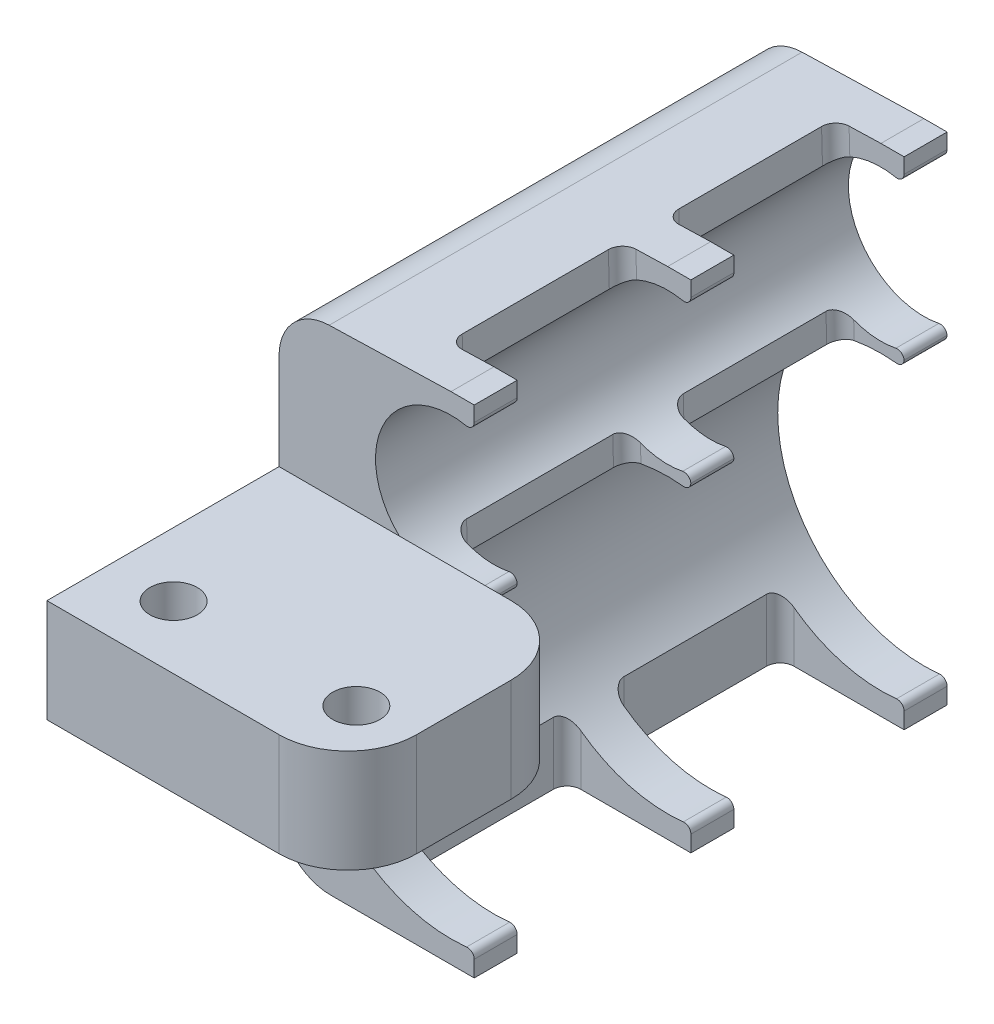
from build123d import *

# Parameters (mm, degrees)
BOSS_EXTRUDE1_DEPTH     = 69.85
CUT_EXTRUDE1_DEPTH      = 2.54
CUT_EXTRUDE1_DEPTH_BACK = 105.044993435
SKETCH2_W               = 16.044844987
SKETCH2_H               = 25.145576203
SKETCH2_H_2             = 25.654423797
CUT_EXTRUDE2_DEPTH      = 13.97
FILLET1_R               = 1.016
FILLET2_R               = 2.032
SKETCH4_W               = 34.29
SKETCH4_H               = 15.24
BOSS_EXTRUDE2_DEPTH     = 44.45
FILLET3_R               = 10.16
SKETCH5_R               = 3.5
CUT_EXTRUDE3_DEPTH      = 91.143248047
FILLET4_R               = 7.62


with BuildPart() as part:
    # Sketch1 → Boss-Extrude1 (new body)
    with BuildSketch(Plane.XY):
        with BuildLine():
            Line((3.429, -21.315957849), (3.429, -24.871957849))
            Line((3.429, -24.871957849), (0, -24.871957849))
            Line((0, -24.871957849), (-25.4, -24.871957849))
            Line((-25.4, -24.871957849), (-25.4, 47.724146141))
            Line((-25.4, 47.724146141), (0, 48.429639909))
            Line((0, 48.429639909), (3.429, 48.429639909))
            Line((3.429, 48.429639909), (3.429, 44.873639909))
            ThreePointArc((3.429, 44.873639909), (-11.15, 34.264), (3.429, 23.654360091))
            Line((3.429, 23.654360091), (3.429, 21.315957849))
            ThreePointArc((3.429, 21.315957849), (-21.59, 0), (3.429, -21.315957849))
        make_face()
    extrude(amount=-BOSS_EXTRUDE1_DEPTH)

    # Sketch2 → Cut-Extrude1 (cut, two sides: drawn at the far end of the back side and taken through both)
    with BuildSketch(Plane(origin=(-1.344113023, 48.392306706, 0), x_dir=(0.9996144881434057, 0.027764637469221053, 0), z_dir=(-0.027764637469221053, 0.9996144881434057, 0)).offset(-CUT_EXTRUDE1_DEPTH_BACK)):
        with Locations((2.634731969, 50.927211899)):
            Rectangle(SKETCH2_W, SKETCH2_H)
        with Locations((2.634731969, 19.177211899)):
            Rectangle(SKETCH2_W, SKETCH2_H_2)
    extrude(amount=CUT_EXTRUDE1_DEPTH + CUT_EXTRUDE1_DEPTH_BACK, mode=Mode.SUBTRACT)

    # Sketch3 → Cut-Extrude2 (cut)
    with BuildSketch(Plane.XZ.offset(24.871957849)):
        Polygon((-4.69894113, -6.35), (-14.85894113, -6.35), (-14.85894113, -32.004423797), (-7.683449997, -32.004423797), (-4.37926474, -32.004423797), (-4.37926474, -6.35), align=None)
        Polygon((-4.69894113, -38.354423797), (-14.85894113, -38.354423797), (-14.85894113, -63.5), (-7.683449997, -63.5), (-2.422701427, -63.5), (-2.422701427, -38.354423797), align=None)
    extrude(amount=-CUT_EXTRUDE2_DEPTH, mode=Mode.SUBTRACT)

    # Fillet1
    # the kernel refuses this fillet: 1.016 mm, written as the material it takes off along each edge
    with BuildSketch(Plane(origin=(3.429, -21.315957849, -60.597776235), x_dir=(-0.9911390490997786, -0.13282840565777682, 0), z_dir=(0, 0, -1)), Plane(origin=(3.429, -21.315957849, -29.102200032), x_dir=(-0.9911390490997786, -0.13282840565777682, 0), z_dir=(0, 0, -1))) as fillet1_piece_1:
        with BuildLine():
            CenterArc((1.161196376, -1.015649261), FILLET1_R, 91.505550469, 96.127515329)
            Line((0.154199102, -1.150602921), (0, 0))
            ThreePointArc((0, 0), (0.567251103, -0.007453204), (1.134502207, 0))
        make_face()
    extrude(amount=12.15444753, mode=Mode.SUBTRACT)
    with BuildSketch(Plane(origin=(3.429, 44.873639909, -60.213343849), x_dir=(-0.967377188342964, 0.25334043394938266, 0), z_dir=(0, 0, -1)), Plane(origin=(3.429, 44.873639909, -28.717767646), x_dir=(-0.967377188342964, 0.25334043394938266, 0), z_dir=(0, 0, -1)), Plane(origin=(3.429, 44.873639909, 3.286656151), x_dir=(-0.967377188342964, 0.25334043394938266, 0), z_dir=(0, 0, -1))) as fillet1_piece_2:
        with BuildLine():
            CenterArc((1.315912382, 1.014380594), FILLET1_R, 165.324729703, 101.43988218)
            Line((0.333057158, 1.271774475), (0, 0))
            ThreePointArc((0, 0), (0.6292856, 0.017772027), (1.2585712, 0))
        make_face()
    extrude(amount=12.923312302, mode=Mode.SUBTRACT)
    with BuildSketch(Plane(origin=(3.429, 23.654360091, -60.213343849), x_dir=(-0.9673771883429638, -0.2533404339493828, 0), z_dir=(0, 0, -1)), Plane(origin=(3.429, 23.654360091, -28.717767646), x_dir=(-0.9673771883429638, -0.2533404339493828, 0), z_dir=(0, 0, -1)), Plane(origin=(3.429, 23.654360091, 3.286656151), x_dir=(-0.9673771883429638, -0.2533404339493828, 0), z_dir=(0, 0, -1))) as fillet1_piece_3:
        with BuildLine():
            CenterArc((1.315912382, -1.014380594), FILLET1_R, 93.235388117, 101.43988218)
            Line((0.333057158, -1.271774475), (0, 0))
            ThreePointArc((0, 0), (0.6292856, -0.017772027), (1.2585712, 0))
        make_face()
    extrude(amount=12.923312302, mode=Mode.SUBTRACT)
    with BuildSketch(Plane(origin=(3.429, 21.315957849, -60.597776235), x_dir=(-0.9911390490997777, 0.13282840565778328, 0), z_dir=(0, 0, -1)), Plane(origin=(3.429, 21.315957849, -29.102200032), x_dir=(-0.9911390490997777, 0.13282840565778328, 0), z_dir=(0, 0, -1)), Plane(origin=(3.429, 21.315957849, 2.902223765), x_dir=(-0.9911390490997777, 0.13282840565778328, 0), z_dir=(0, 0, -1))) as fillet1_piece_4:
        with BuildLine():
            CenterArc((1.161196376, 1.015649261), FILLET1_R, 172.366934203, 96.127515328)
            Line((0.154199102, 1.150602921), (0, 0))
            ThreePointArc((0, 0), (0.567251103, 0.007453204), (1.134502207, 0))
        make_face()
    extrude(amount=12.15444753, mode=Mode.SUBTRACT)
    with BuildSketch(Plane(origin=(3.429, -21.315957849, 2.902223765), x_dir=(0, -1, 0), z_dir=(0, 0, -1))) as fillet1_piece_5:
        with BuildLine():
            CenterArc((1.160889506, 1.016), FILLET1_R, 173.872484672, 96.127515328)
            ThreePointArc((0.150694119, 1.124449438), (0.082734222, 0.561234722), (0, 0))
            Line((0, 0), (1.160889506, 0))
        make_face()
    extrude(amount=12.15444753, mode=Mode.SUBTRACT)

    # Fillet2
    fillet2_edges = [part.edges().sort_by_distance(p)[0] for p in [
        (-14.85894113, -20.267644911, -6.35),
        (-14.85894113, -20.267644911, -32.004423797),
        (-14.85894113, -20.267644911, -38.354423797),
        (-14.85894113, -20.267644911, -63.5),
        (-6.023991911, 22.834048029, -63.5),
        (-6.660489458, 45.749966547, -63.5),
        (-6.660489458, 45.749966547, -38.354423797),
        (-6.023991911, 22.834048029, -38.354423797),
        (-6.023991911, 22.834048029, -32.004423797),
        (-6.660489458, 45.749966547, -32.004423797),
        (-6.660489458, 45.749966547, -6.35),
        (-6.023991911, 22.834048029, -6.35),
    ]]
    fillet(fillet2_edges, radius=FILLET2_R)

    # Sketch4 → Boss-Extrude2 (add)
    with BuildSketch(Plane.ZY.offset(25.4)):
        with Locations((17.145, 18.514146141)):
            Rectangle(SKETCH4_W, SKETCH4_H)
    extrude(amount=-BOSS_EXTRUDE2_DEPTH)

    # Fillet3
    fillet3_edges = [part.edges().sort_by_distance(p)[0] for p in [
        (19.05, 18.514146141, 0),
        (19.05, 18.514146141, 34.29),
    ]]
    fillet(fillet3_edges, radius=FILLET3_R)

    # Sketch5 → Cut-Extrude3 (cut, through all)
    with BuildSketch(Plane(origin=(0, 26.134146141, 0), x_dir=(1, 0, 0), z_dir=(0, 1, 0))):
        with Locations(Location((10.91, -24.892, 0), (0, 0, 270))):
            Circle(SKETCH5_R)
        with Locations(Location((-15.98, -25, 0), (0, 0, 270))):
            Circle(SKETCH5_R)
    extrude(amount=-CUT_EXTRUDE3_DEPTH, mode=Mode.SUBTRACT)

    # Fillet4
    fillet4_edges = [part.edges().sort_by_distance(p)[0] for p in [
        (-25.4, -24.871957849, -34.925),
        (-25.4, 47.724146141, -34.925),
    ]]
    fillet(fillet4_edges, radius=FILLET4_R)


solid = part.part
